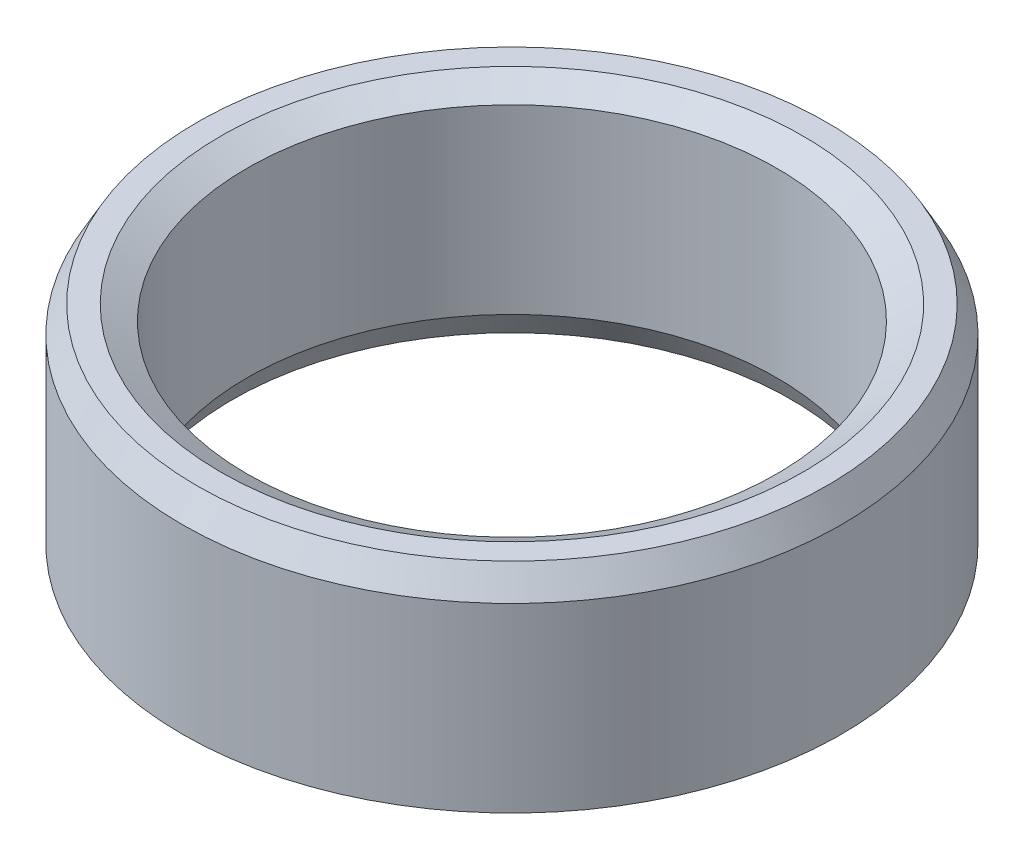
from build123d import *
from OCP.BRepFilletAPI import BRepFilletAPI_MakeChamfer

# Parameters (mm, degrees)
SKETCH1_R           = 50
BOSS_EXTRUDE1_DEPTH = 33.75682552
SKETCH2_R           = 40.18043486
CUT_EXTRUDE1_DEPTH  = 79.355110039
CHAMFER1_SIZE       = 3.988158929
CHAMFER1_SIZE2      = 2.230664203


with BuildPart() as part:
    # Sketch1 → Boss-Extrude1 (new body)
    with BuildSketch(Plane(origin=(0, 0, 0), x_dir=(1, 0, 0), z_dir=(0, 1, 0))):
        Circle(SKETCH1_R)
    extrude(amount=BOSS_EXTRUDE1_DEPTH)

    # Sketch2 → Cut-Extrude1 (cut, through all)
    with BuildSketch(Plane(origin=(0, 0, 0), x_dir=(1, 0, 0), z_dir=(0, 1, 0))):
        Circle(SKETCH2_R)
    extrude(amount=CUT_EXTRUDE1_DEPTH, mode=Mode.SUBTRACT)

    # Chamfer1: one chamfer whose edges measure the first distance from different faces: ONE call of the kernel's chamfer builder (chamfer() names one face for all edges)
    chamfer1_edges_1 = [part.edges().sort_by_distance(p)[0] for p in [
        (-40.18043486, 33.75682552, 0),
    ]]
    chamfer1_side_1 = [part.faces().sort_by_distance(p)[0] for p in [
        (-48.585786438, 33.75682552, 0),
    ]]
    chamfer1_edges_2 = [part.edges().sort_by_distance(p)[0] for p in [
        (-40.18043486, 0, 0),
    ]]
    chamfer1_side_2 = [part.faces().sort_by_distance(p)[0] for p in [
        (-40.18043486, 16.87841276, 0),
    ]]
    chamfer1_edges_3 = [part.edges().sort_by_distance(p)[0] for p in [
        (-50, 0, 0),
    ]]
    chamfer1_side_3 = [part.faces().sort_by_distance(p)[0] for p in [
        (-48.585786438, 0, 0),
    ]]
    chamfer1_edges_4 = [part.edges().sort_by_distance(p)[0] for p in [
        (-50, 33.75682552, 0),
    ]]
    chamfer1_side_4 = [part.faces().sort_by_distance(p)[0] for p in [
        (-50, 16.87841276, 0),
    ]]
    chamfer1 = BRepFilletAPI_MakeChamfer(part.part.solid().wrapped)
    for e in chamfer1_edges_1:
        chamfer1.Add(CHAMFER1_SIZE, CHAMFER1_SIZE2, e.wrapped, chamfer1_side_1[0].wrapped)  # the first distance lies on this face
    for e in chamfer1_edges_2:
        chamfer1.Add(CHAMFER1_SIZE, CHAMFER1_SIZE2, e.wrapped, chamfer1_side_2[0].wrapped)  # the first distance lies on this face
    for e in chamfer1_edges_3:
        chamfer1.Add(CHAMFER1_SIZE, CHAMFER1_SIZE2, e.wrapped, chamfer1_side_3[0].wrapped)  # the first distance lies on this face
    for e in chamfer1_edges_4:
        chamfer1.Add(CHAMFER1_SIZE, CHAMFER1_SIZE2, e.wrapped, chamfer1_side_4[0].wrapped)  # the first distance lies on this face
    add(Compound.cast(chamfer1.Shape()), mode=Mode.REPLACE)


solid = part.part
